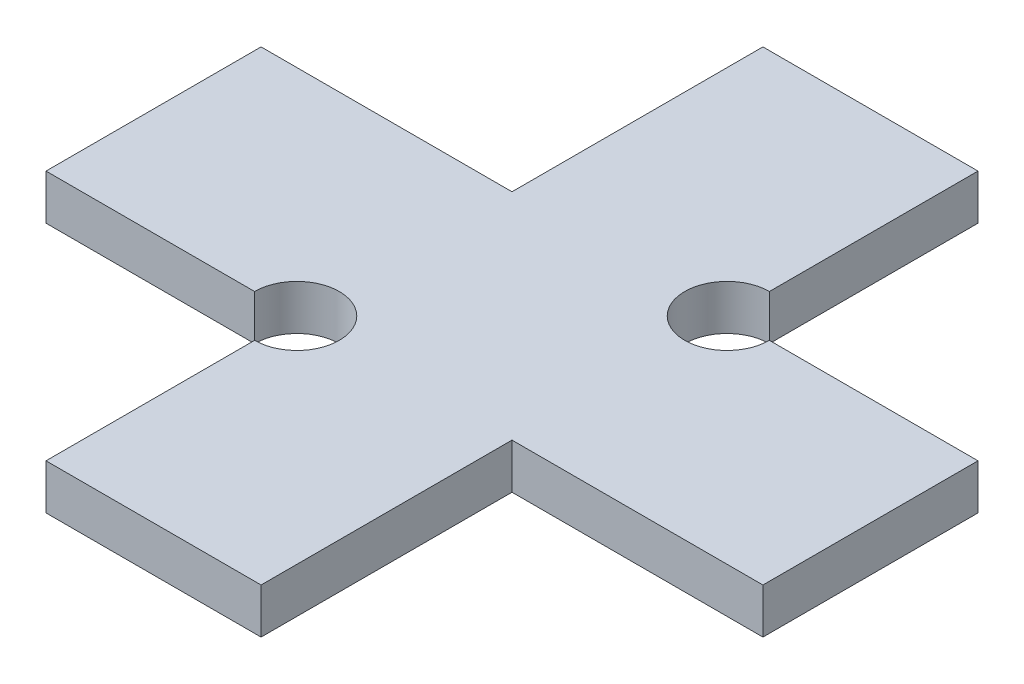
from build123d import *

# Parameters (mm, degrees)
BOSS_EXTRUDE1_DEPTH = 1.6


with BuildPart() as part:
    # Sketch1 → Boss-Extrude1 (new body)
    with BuildSketch(Plane(origin=(0, 0, 0), x_dir=(1, 0, 0), z_dir=(0, 1, 0))):
        with BuildLine():
            Line((-3.81, -12.7), (3.81, -12.7))
            Line((3.81, -12.7), (3.81, -3.81))
            Line((3.81, -3.81), (12.7, -3.81))
            Line((12.7, -3.81), (12.7, 3.81))
            Line((12.7, 3.81), (5.31, 3.81))
            ThreePointArc((5.31, 3.81), (2.749339828, 2.749339828), (3.81, 5.31))
            Line((3.81, 5.31), (3.81, 12.7))
            Line((3.81, 12.7), (-3.81, 12.7))
            Line((-3.81, 12.7), (-3.81, 3.81))
            Line((-3.81, 3.81), (-12.7, 3.81))
            Line((-12.7, 3.81), (-12.7, -3.81))
            Line((-12.7, -3.81), (-5.31, -3.81))
            ThreePointArc((-5.31, -3.81), (-2.749339828, -2.749339828), (-3.81, -5.31))
            Line((-3.81, -5.31), (-3.81, -12.7))
        make_face()
    extrude(amount=BOSS_EXTRUDE1_DEPTH)


solid = part.part
